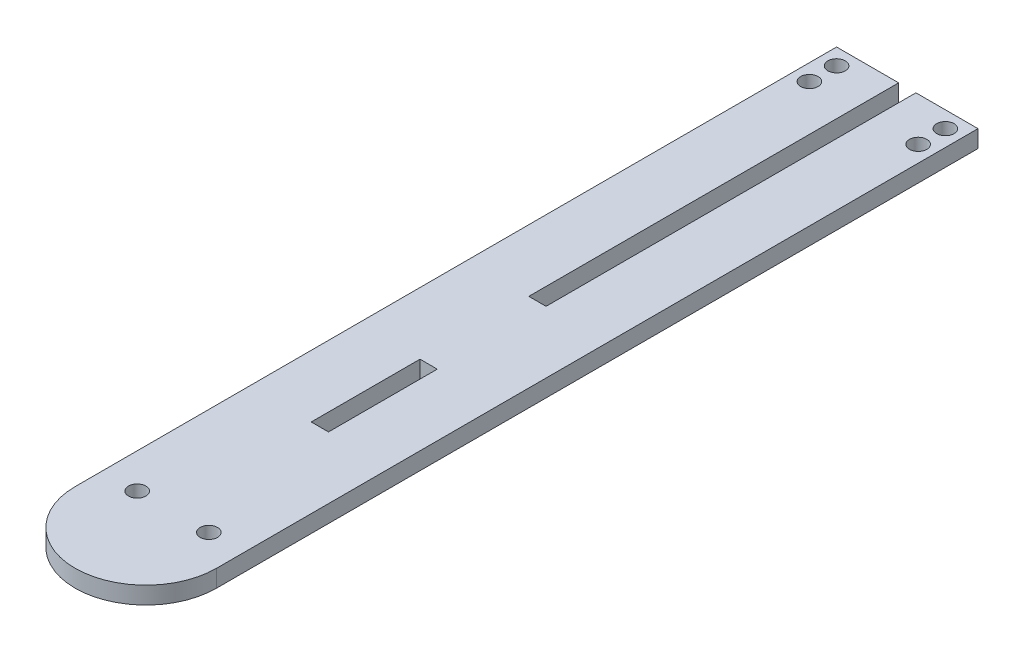
from build123d import *

# Parameters (mm, degrees)
SKETCH1_W               = 3.175
SKETCH1_H               = 20
BOSS_EXTRUDE1_DEPTH     = 3.175
CUT_EXTRUDE1_DEPTH      = 154.72662678
CUT_EXTRUDE1_DEPTH_BACK = 154.72662678
SKETCH2_R               = 1.6
CUT_EXTRUDE2_DEPTH      = 154.72662678
CUT_EXTRUDE2_DEPTH_BACK = 154.72662678
SKETCH3_R               = 1.6


with BuildPart() as part:
    # Sketch1 → Boss-Extrude1 (new body)
    with BuildSketch(Plane(origin=(0, 0, 0), x_dir=(1, 0, 0), z_dir=(0, 1, 0))):
        with BuildLine():
            Line((-14.5875, 0), (-14.5875, -140))
            ThreePointArc((-14.5875, -140), (-1.5875, -153), (11.4125, -140))
            Line((11.4125, -140), (11.4125, 0))
            Line((11.4125, 0), (0, 0))
            Line((0, 0), (0, -68))
            Line((0, -68), (-3.175, -68))
            Line((-3.175, -68), (-3.175, 0))
            Line((-3.175, 0), (-14.5875, 0))
        make_face()
        with Locations((-1.5875, -98)):
            Rectangle(SKETCH1_W, SKETCH1_H, mode=Mode.SUBTRACT)
    extrude(amount=BOSS_EXTRUDE1_DEPTH)

    # Sketch2 → Cut-Extrude1 (cut, two sides: drawn at the far end of the back side and taken through both)
    with BuildSketch(Plane(origin=(0, 3.175, 0), x_dir=(1, 0, 0), z_dir=(0, 1, 0)).offset(-CUT_EXTRUDE1_DEPTH_BACK)):
        with Locations((5, -135)):
            Circle(SKETCH2_R)
        with Locations((-8.175, -135)):
            Circle(SKETCH2_R)
    extrude(amount=CUT_EXTRUDE1_DEPTH + CUT_EXTRUDE1_DEPTH_BACK, mode=Mode.SUBTRACT)

    # Sketch3 → Cut-Extrude2 (cut, two sides: drawn at the far end of the back side and taken through both)
    with BuildSketch(Plane(origin=(0, 3.175, 0), x_dir=(1, 0, 0), z_dir=(0, 1, 0)).offset(-CUT_EXTRUDE2_DEPTH_BACK)):
        with Locations((-11.5875, -8)):
            Circle(SKETCH3_R)
        with Locations((-11.5875, -3)):
            Circle(SKETCH3_R)
        with Locations((8.4125, -8)):
            Circle(SKETCH3_R)
        with Locations((8.4125, -3)):
            Circle(SKETCH3_R)
    extrude(amount=CUT_EXTRUDE2_DEPTH + CUT_EXTRUDE2_DEPTH_BACK, mode=Mode.SUBTRACT)


solid = part.part
